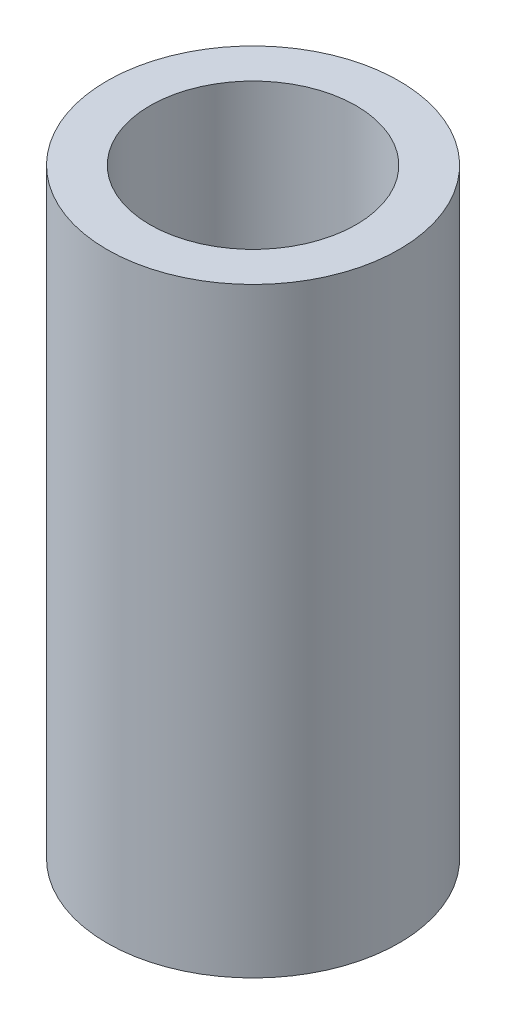
from build123d import *

# Parameters (mm, degrees)
SKETCH1_R           = 34
SKETCH1_R_2         = 24
BOSS_EXTRUDE1_DEPTH = 139.8
SKETCH2_R           = 12.53
CUT_EXTRUDE1_DEPTH  = 148.837884184


with BuildPart() as part:
    # Sketch1 → Boss-Extrude1 (new body)
    with BuildSketch(Plane(origin=(0, 0, 0), x_dir=(1, 0, 0), z_dir=(0, 1, 0))):
        Circle(SKETCH1_R)
        Circle(SKETCH1_R_2, mode=Mode.SUBTRACT)
    extrude(amount=BOSS_EXTRUDE1_DEPTH)

    # Sketch2 → Cut-Extrude1 (cut, through all)
    with BuildSketch(Plane(origin=(0, 0, 0), x_dir=(0, 0, -1), z_dir=(1, 0, 0))):
        with Locations((0, 22.6)):
            Circle(SKETCH2_R)
        with Locations((0, 75.6)):
            Circle(SKETCH2_R)
    extrude(amount=-CUT_EXTRUDE1_DEPTH, mode=Mode.SUBTRACT)


solid = part.part
